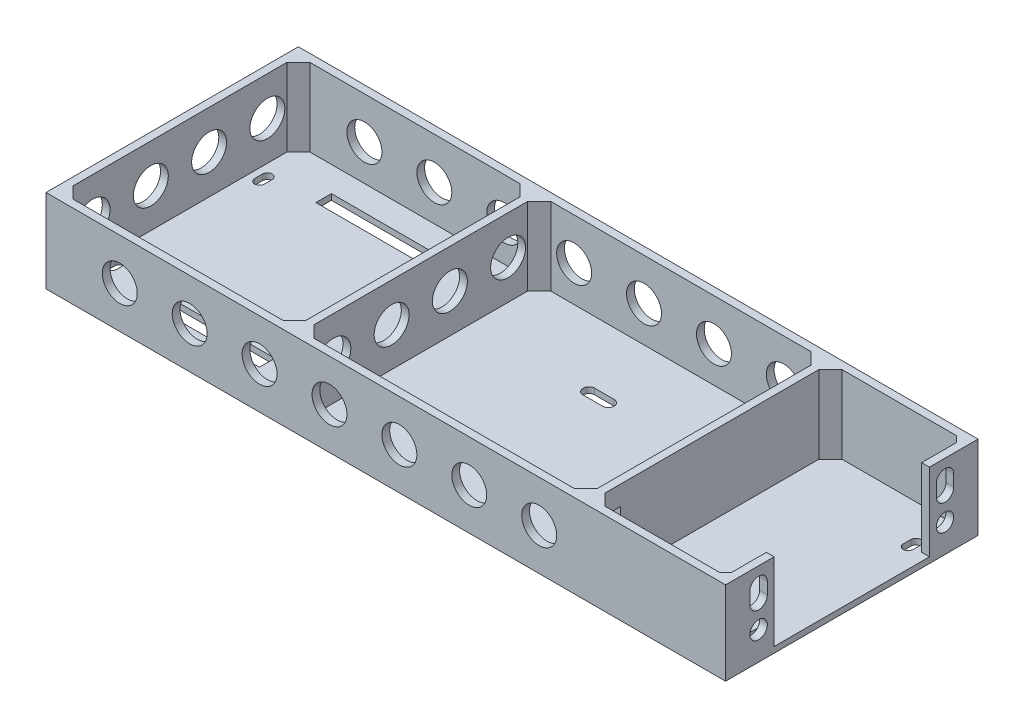
from build123d import *

# Parameters (mm, degrees)
SKETCH_1_W             = 175
SKETCH_1_H             = 65
EXTRUDE_1_DEPTH        = 1.5
SKETCH_3_W             = 175
SKETCH_3_H             = 65
SKETCH_3_W_2           = 171
SKETCH_3_H_2           = 61
EXTRUDE_2_DEPTH        = 20
SKETCH_4_W             = 40
SKETCH_4_H             = 20
CUT_EXTRUDE_1_DEPTH    = 2
SKETCH_6_R             = 2.25
CUT_EXTRUDE_2_DEPTH    = 2
SKETCH_9_W             = 2
SKETCH_9_H             = 61
EXTRUDE_4_DEPTH        = 20
SKETCH_12_W            = 4
SKETCH_12_H            = 10
CUT_EXTRUDE_4_DEPTH    = 2
CHAMFER_1_SIZE         = 3
CHAMFER_2_SIZE         = 3
CHAMFER_3_SIZE         = 1.5
SKETCH_13_R            = 4.5
CUT_EXTRUDE_5_DEPTH    = 71
PATTERN_LINEAR_1_COUNT = 7
PATTERN_LINEAR_1_PITCH = 18
SKETCH_14_W            = 2
SKETCH_14_H            = 61
EXTRUDE_5_DEPTH        = 20
CHAMFER_4_SIZE         = 3
CHAMFER_5_SIZE         = 3
SKETCH_15_R            = 4.5
CUT_EXTRUDE_6_DEPTH    = 71
PATTERN_LINEAR_2_COUNT = 4
PATTERN_LINEAR_2_PITCH = 15
CUT_EXTRUDE_7_DEPTH    = 4
SKETCH_18_W            = 27
SKETCH_18_H            = 4
CUT_EXTRUDE_8_DEPTH    = 5
CUT_EXTRUDE_9_DEPTH    = 10


# Some blends are built 0.0001 mm under size
with BuildPart() as part:
    # Эскиз1 → Бобышка-Вытянуть1 (new body)
    with BuildSketch(Plane(origin=(0, 0, 0), x_dir=(1, 0, 0), z_dir=(0, 1, 0))):
        Rectangle(SKETCH_1_W, SKETCH_1_H)
    extrude(amount=EXTRUDE_1_DEPTH)

    # Эскиз3 → Бобышка-Вытянуть2 (add)
    with BuildSketch(Plane(origin=(0, 1.5, 0), x_dir=(1, 0, 0), z_dir=(0, 1, 0))):
        Rectangle(SKETCH_3_W, SKETCH_3_H)
        Rectangle(SKETCH_3_W_2, SKETCH_3_H_2, mode=Mode.SUBTRACT)
    extrude(amount=EXTRUDE_2_DEPTH)

    # Эскиз4 → Вырез-Вытянуть1 (cut)
    with BuildSketch(Plane(origin=(87.5, 0, 0), x_dir=(0, 0, -1), z_dir=(1, 0, 0))):
        with Locations((0, 11.5)):
            Rectangle(SKETCH_4_W, SKETCH_4_H)
    extrude(amount=-CUT_EXTRUDE_1_DEPTH, mode=Mode.SUBTRACT)

    # Эскиз6 → Вырез-Вытянуть2 (cut)
    with BuildSketch(Plane(origin=(87.5, 0, 0), x_dir=(0, 0, -1), z_dir=(1, 0, 0))):
        with Locations((-24, 7.25)):
            Circle(SKETCH_6_R)
        with BuildLine():
            Line((-21.75, 16.918419021), (-21.75, 13.918419021))
            ThreePointArc((-21.75, 13.918419021), (-24, 11.668419021), (-26.25, 13.918419021))
            Line((-26.25, 13.918419021), (-26.25, 16.918419021))
            ThreePointArc((-26.25, 16.918419021), (-24, 19.168419021), (-21.75, 16.918419021))
        make_face()
    cut_extrude_2 = extrude(amount=-CUT_EXTRUDE_2_DEPTH, mode=Mode.SUBTRACT)

    # Зеркальное отражение2: Вырез-Вытянуть2 across plane
    add(cut_extrude_2.mirror(Plane(origin=(0, 0, 0), x_dir=(1, 0, 0), z_dir=(0, 0, -1))), mode=Mode.SUBTRACT)

    # Эскиз9 → Бобышка-Вытянуть4 (add)
    with BuildSketch(Plane(origin=(0, 1.5, 0), x_dir=(1, 0, 0), z_dir=(0, 1, 0))):
        with Locations((50.5, 0)):
            Rectangle(SKETCH_9_W, SKETCH_9_H)
    extrude(amount=EXTRUDE_4_DEPTH)

    # Эскиз12 → Вырез-Вытянуть4 (cut)
    with BuildSketch(Plane(origin=(51.5, 0, 0), x_dir=(0, 0, -1), z_dir=(1, 0, 0))):
        with Locations((-25.5, 11.5)):
            Rectangle(SKETCH_12_W, SKETCH_12_H)
    extrude(amount=-CUT_EXTRUDE_4_DEPTH, mode=Mode.SUBTRACT)

    # Фаска1
    chamfer_1_edges = [part.edges().sort_by_distance(p)[0] for p in [
        (-85.5, 11.5, -30.5),
        (-85.5, 11.5, 30.5),
        (49.5, 11.5, -30.5),
        (49.5, 11.5, 30.5),
    ]]
    chamfer(chamfer_1_edges, length=CHAMFER_1_SIZE - 0.0001)  # a hair under: the kernel refuses the full size

    # Фаска2
    chamfer_2_edges = [part.edges().sort_by_distance(p)[0] for p in [
        (51.5, 11.5, 30.5),
        (51.5, 11.5, -30.5),
    ]]
    chamfer(chamfer_2_edges, length=CHAMFER_2_SIZE - 0.0001)  # a hair under: the kernel refuses the full size

    # Фаска3
    chamfer_3_edges = [part.edges().sort_by_distance(p)[0] for p in [
        (85.5, 11.5, 30.5),
        (85.5, 11.5, -30.5),
    ]]
    chamfer(chamfer_3_edges, length=CHAMFER_3_SIZE)

    # Эскиз13 → Вырез-Вытянуть5 (cut)
    with BuildSketch(Plane(origin=(0, 0, -32.5), x_dir=(-1, 0, 0), z_dir=(0, 0, -1))):
        with Locations((-39.5, 10.75)):
            Circle(SKETCH_13_R)
    cut_extrude_5 = extrude(amount=-CUT_EXTRUDE_5_DEPTH, mode=Mode.SUBTRACT)

    # Линейный массив1: Вырез-Вытянуть5 ×7
    with Locations(*[(-i * PATTERN_LINEAR_1_PITCH, 0, 0) for i in range(1, PATTERN_LINEAR_1_COUNT)]):
        add(cut_extrude_5, mode=Mode.SUBTRACT)

    # Эскиз14 → Бобышка-Вытянуть5 (add)
    with BuildSketch(Plane(origin=(0, 1.5, 0), x_dir=(1, 0, 0), z_dir=(0, 1, 0))):
        with Locations((-24.5, 0)):
            Rectangle(SKETCH_14_W, SKETCH_14_H)
    extrude(amount=EXTRUDE_5_DEPTH)

    # Фаска4
    # the kernel refuses this chamfer: 3 mm, written as the material it adds along each edge
    with BuildSketch(Plane(origin=(-25.5, 1.5, -30.5), x_dir=(-0.9996219169112968, 0, -0.027495876610586733), z_dir=(0, 1, 0))) as chamfer_4_piece_1_section:
        Polygon((CHAMFER_4_SIZE * 0.999621916911, CHAMFER_4_SIZE * 0.0274958766106), (-CHAMFER_4_SIZE * 0.0274958766106, CHAMFER_4_SIZE * 0.999621916911), (0, 0), align=None)
    chamfer_4_piece_1 = extrude(amount=20, mode=Mode.PRIVATE)
    chamfer_4_piece_1 = chamfer_4_piece_1 - Plane(origin=(-32.5, 10.75, -29.506003932), x_dir=(-1, 0, 0), z_dir=(0, 0, -1)) * Cylinder(4.5, 52, mode=Mode.PRIVATE)
    add(chamfer_4_piece_1)
    with BuildSketch(Plane(origin=(-25.5, 1.5, 30.5), x_dir=(-0.9996219169112968, 0, 0.0274958766105868), z_dir=(0, 1, 0))) as chamfer_4_piece_2_section:
        Polygon((CHAMFER_4_SIZE * 0.999621916911, -CHAMFER_4_SIZE * 0.0274958766106), (-CHAMFER_4_SIZE * 0.0274958766106, -CHAMFER_4_SIZE * 0.999621916911), (0, 0), align=None)
    chamfer_4_piece_2 = extrude(amount=20, mode=Mode.PRIVATE)
    chamfer_4_piece_2 = chamfer_4_piece_2 - Plane(origin=(-32.5, 10.75, 29.506003932), x_dir=(-1, 0, 0), z_dir=(0, 0, -1)) * Cylinder(4.5, 52, mode=Mode.PRIVATE)
    add(chamfer_4_piece_2)

    # Фаска5
    chamfer_5_edges = [part.edges().sort_by_distance(p)[0] for p in [
        (-23.5, 11.5, 30.5),
        (-23.5, 11.5, -30.5),
    ]]
    chamfer(chamfer_5_edges, length=CHAMFER_5_SIZE)

    # Эскиз15 → Вырез-Вытянуть6 (cut)
    with BuildSketch(Plane(origin=(-23.5, 0, 0), x_dir=(0, 0, -1), z_dir=(1, 0, 0))):
        with Locations((-22.5, 11.5)):
            Circle(SKETCH_15_R)
    cut_extrude_6 = extrude(amount=-CUT_EXTRUDE_6_DEPTH, mode=Mode.SUBTRACT)

    # Линейный массив2: Вырез-Вытянуть6 ×4
    with Locations(*[(0, 0, -i * PATTERN_LINEAR_2_PITCH) for i in range(1, PATTERN_LINEAR_2_COUNT)]):
        add(cut_extrude_6, mode=Mode.SUBTRACT)

    # Эскиз16 → Вырез-Вытянуть7 (cut)
    with BuildSketch(Plane(origin=(0, 1.5, 0), x_dir=(1, 0, 0), z_dir=(0, 1, 0))):
        with BuildLine():
            Line((6.8, 14.5), (11.8, 14.5))
            ThreePointArc((11.8, 14.5), (13.3, 13), (11.8, 11.5))
            Line((11.8, 11.5), (6.8, 11.5))
            ThreePointArc((6.8, 11.5), (5.3, 13), (6.8, 14.5))
        make_face()
        with BuildLine():
            Line((39.5, 14.5), (44.5, 14.5))
            ThreePointArc((44.5, 14.5), (46, 13), (44.5, 11.5))
            Line((44.5, 11.5), (39.5, 11.5))
            ThreePointArc((39.5, 11.5), (38, 13), (39.5, 14.5))
        make_face()
    extrude(amount=-CUT_EXTRUDE_7_DEPTH, mode=Mode.SUBTRACT)

    # Эскиз18 → Вырез-Вытянуть8 (cut)
    with BuildSketch(Plane(origin=(0, 1.5, 0), x_dir=(1, 0, 0), z_dir=(0, 1, 0))):
        with Locations((-57, 22)):
            Rectangle(SKETCH_18_W, SKETCH_18_H)
        with Locations((-54.553283303, -22)):
            Rectangle(SKETCH_18_W, SKETCH_18_H)
    extrude(amount=-CUT_EXTRUDE_8_DEPTH, mode=Mode.SUBTRACT)

    # Эскиз19 → Вырез-Вытянуть9 (cut)
    with BuildSketch(Plane(origin=(0, 1.5, 0), x_dir=(1, 0, 0), z_dir=(0, 1, 0))):
        with BuildLine():
            Line((83.75, 21.5), (83.75, 19.5))
            ThreePointArc((83.75, 19.5), (82.5, 18.25), (81.25, 19.5))
            Line((81.25, 19.5), (81.25, 21.5))
            ThreePointArc((81.25, 21.5), (82.5, 22.75), (83.75, 21.5))
        make_face()
        with BuildLine():
            Line((83.75, -18.5), (83.75, -20.5))
            ThreePointArc((83.75, -20.5), (82.5, -21.75), (81.25, -20.5))
            Line((81.25, -20.5), (81.25, -18.5))
            ThreePointArc((81.25, -18.5), (82.5, -17.25), (83.75, -18.5))
        make_face()
        with BuildLine():
            Line((-81.25, 19.5), (-81.25, 17.5))
            ThreePointArc((-81.25, 17.5), (-82.5, 16.25), (-83.75, 17.5))
            Line((-83.75, 17.5), (-83.75, 19.5))
            ThreePointArc((-83.75, 19.5), (-82.5, 20.75), (-81.25, 19.5))
        make_face()
        with BuildLine():
            Line((-81.25, -18.5), (-81.25, -20.5))
            ThreePointArc((-81.25, -20.5), (-82.5, -21.75), (-83.75, -20.5))
            Line((-83.75, -20.5), (-83.75, -18.5))
            ThreePointArc((-83.75, -18.5), (-82.5, -17.25), (-81.25, -18.5))
        make_face()
    extrude(amount=-CUT_EXTRUDE_9_DEPTH, mode=Mode.SUBTRACT)


solid = part.part
